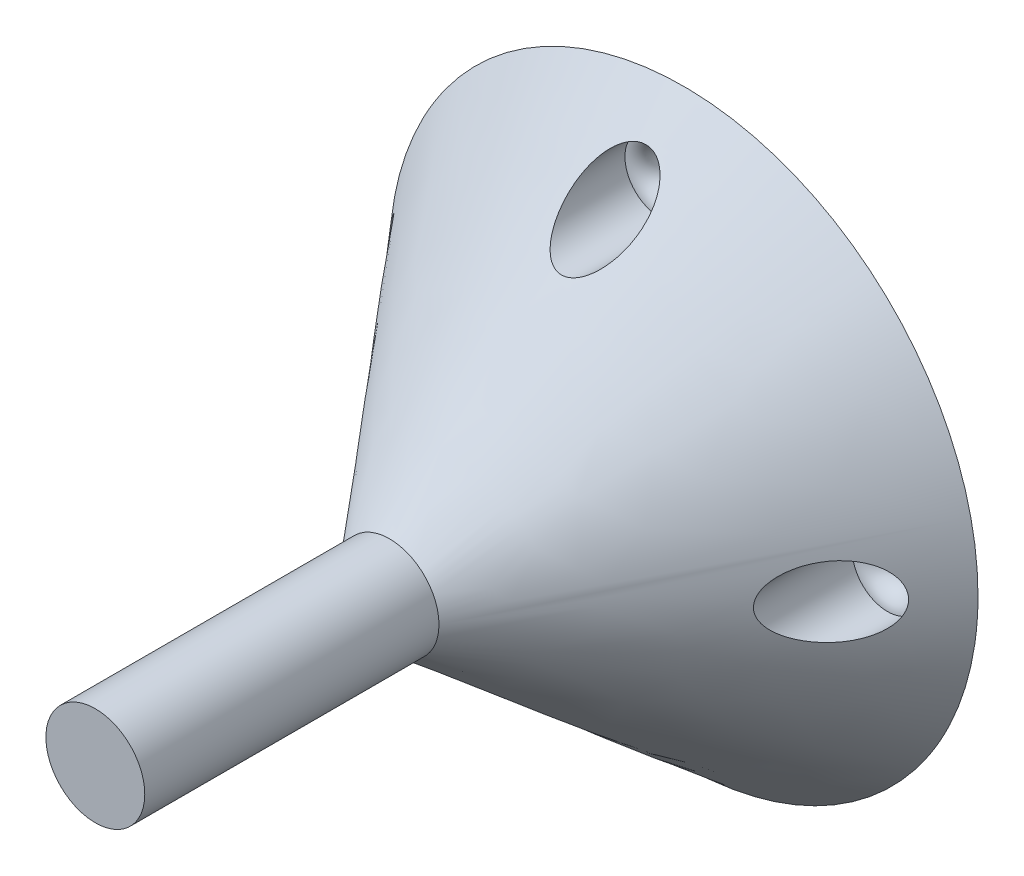
from build123d import *

# Parameters (mm, degrees)
SCHIZZO3_R                   = 4.2
ESTRUSIONE_ESTRUSIONE1_DEPTH = 25
SCHIZZO4_R                   = 1.6000000000000003
SCHIZZO4_R_2                 = 1.6000000000000016
TAGLIO_ESTRUSIONE1_DEPTH     = 25
SCHIZZO5_R                   = 2.9999999999999996
SCHIZZO5_R_2                 = 3.0000000000004285
SCHIZZO5_R_3                 = 3.000000000001174
SCHIZZO5_R_4                 = 3.0000000000008766
TAGLIO_ESTRUSIONE2_DEPTH     = 22.999999999999993
RACCORDO1_R                  = 1.5
RACCORDO2_R                  = 1.5
RACCORDO3_R                  = 1.5
RACCORDO4_R                  = 1.5


with BuildPart() as part:
    # Loft1: read off the stored shape, not the designer's step
    # Loft1: loft between two sections, ruled curve by curve
    loft1_from = [
        Edge.make_bspline([(-24.22237273, 6.186813341, 0), (-36.595999412, -42.25793212, 0), (11.848746049, -54.631558801, 0), (24.22237273, -6.186813341, 0), (36.595999412, 42.25793212, 0), (-11.848746049, 54.631558801, 0), (-24.22237273, 6.186813341, 0)], [0, 0, 0, 0, 0.5, 0.5, 0.5, 1, 1, 1, 1], 3, [1, 0.333333333333333, 0.333333333333333, 1, 0.333333333333333, 0.333333333333333, 1]),
    ]
    loft1_to = [
        Edge.make_bspline([(-3.742227402, 1.906760099, 25), (-7.555747599, -5.577694704, 25), (-0.071292796, -9.391214902, 25), (3.742227402, -1.906760099, 25), (7.555747599, 5.577694704, 25), (0.071292796, 9.391214902, 25), (-3.742227402, 1.906760099, 25)], [0, 0, 0, 0, 0.5, 0.5, 0.5, 1, 1, 1, 1], 3, [1, 0.333333333333333, 0.333333333333333, 1, 0.333333333333333, 0.333333333333333, 1]),
    ]
    loft1 = Solid(Shell([*[Face.make_surface_from_curves(loft1_from[k], loft1_to[k]) for k in range(1)], Face(Wire(loft1_from)), Face(Wire(loft1_to))]))
    add(loft1)

    # Schizzo3 → Estrusione-Estrusione1 (add)
    with BuildSketch(Plane.XY.offset(25)):
        with Locations(Location((0, 0, 0), (0, 0, 153))):
            Circle(SCHIZZO3_R)
    extrude(amount=ESTRUSIONE_ESTRUSIONE1_DEPTH)

    # Schizzo4 → Taglio-Estrusione1 (cut)
    with BuildSketch(Plane.XY.offset(25)):
        with Locations((0, 19.31473002952617)):
            Circle(SCHIZZO4_R)
        with Locations((19.314730029526658, 4.888e-13)):
            Circle(SCHIZZO4_R_2)
        with Locations((9.7759e-13, -19.31473002952617)):
            Circle(SCHIZZO4_R)
        with Locations((-19.314730029525684, -4.9116e-13)):
            Circle(SCHIZZO4_R_2)
    extrude(amount=-TAGLIO_ESTRUSIONE1_DEPTH, mode=Mode.SUBTRACT)

    # Schizzo5 → Taglio-Estrusione2 (cut)
    with BuildSketch(Plane.XY.offset(25)):
        with Locations((0, 19.31473002952617)):
            Circle(SCHIZZO5_R)
        with Locations((19.314730029526718, 5.4659e-13)):
            Circle(SCHIZZO5_R_2)
        with Locations((1.09318e-12, -19.31473002952617)):
            Circle(SCHIZZO5_R_3)
        with Locations((-19.314730029525627, -5.4896e-13)):
            Circle(SCHIZZO5_R_4)
    extrude(amount=-TAGLIO_ESTRUSIONE2_DEPTH, mode=Mode.SUBTRACT)

    # Raccordo1
    # the kernel refuses this fillet: 1.5 mm, written as the material it takes off along each edge
    with BuildSketch(Plane(origin=(-19.314730029525684, -4.9116e-13, 2.000000000000007), x_dir=(1, 0, 0), z_dir=(0, -1, 0))) as raccordo1_piece_1:
        with BuildLine():
            CenterArc((3.1000000000000014, -1.496662954709631), RACCORDO1_R, 93.82255372924298, 86.17744627075702)
            Line((1.6000000000000014, -1.496662954709631), (1.5700000000000003, -1.496662954709631))
            Line((1.5700000000000003, -1.496662954709631), (1.5700000000000003, 0))
            Line((1.5700000000000003, 0), (1.6000000000000014, 0.0299999999999998))
            ThreePointArc((1.6000000000000014, 0.0299999999999998), (2.3000000000004093, 0.0299999999999998), (2.998000000000836, 0.02993325909419253))
            Line((2.998000000000836, 0.02993325909419253), (3.0000000000008207, 0))
        make_face()
    revolve(axis=Axis((-19.314730029525684, -4.9116e-13, 2.000000000000007), (0, 0, 1)), mode=Mode.SUBTRACT)

    # Raccordo2
    # the kernel refuses this fillet: 1.5 mm, written as the material it takes off along each edge
    with BuildSketch(Plane(origin=(0, 19.31473002952617, 2.000000000000007), x_dir=(1, 0, 0), z_dir=(0, -1, 0))) as raccordo2_piece_1:
        with BuildLine():
            CenterArc((3.1000000000000005, -1.4966629547095778), RACCORDO2_R, 93.82255372927438, 86.17744627072562)
            Line((2.9999999999999996, -1.33e-15), (2.9979999999999993, 0.02993325909419031))
            ThreePointArc((2.9979999999999993, 0.02993325909419031), (2.3, 0.0299999999999998), (1.6000000000000003, 0.0299999999999998))
            Line((1.6000000000000003, 0.0299999999999998), (1.5700000000000003, 0))
            Line((1.5700000000000003, 0), (1.5700000000000005, -1.4966629547095778))
            Line((1.5700000000000005, -1.4966629547095778), (1.6000000000000005, -1.4966629547095778))
        make_face()
    revolve(axis=Axis((0, 19.31473002952617, 2.000000000000007), (0, 0, 1)), mode=Mode.SUBTRACT)

    # Raccordo3
    # the kernel refuses this fillet: 1.5 mm, written as the material it takes off along each edge
    with BuildSketch(Plane(origin=(19.314730029526658, 4.888e-13, 2.000000000000007), x_dir=(1, 0, 0), z_dir=(0, -1, 0))) as raccordo3_piece_1:
        with BuildLine():
            CenterArc((3.1000000000000014, -1.4966629547096026), RACCORDO3_R, 93.82255372926026, 86.17744627073972)
            Line((3.0000000000003695, -1.78e-15), (2.9980000000003777, 0.02993325909419031))
            ThreePointArc((2.9980000000003777, 0.02993325909419031), (2.3000000000001855, 0.0299999999999998), (1.6000000000000014, 0.0299999999999998))
            Line((1.6000000000000014, 0.0299999999999998), (1.5700000000000003, 0))
            Line((1.5700000000000003, 0), (1.5700000000000003, -1.4966629547096026))
            Line((1.5700000000000003, -1.4966629547096026), (1.6000000000000014, -1.4966629547096026))
        make_face()
    revolve(axis=Axis((19.314730029526658, 4.888e-13, 2.000000000000007), (0, 0, 1)), mode=Mode.SUBTRACT)

    # Raccordo4
    # the kernel refuses this fillet: 1.5 mm, written as the material it takes off along each edge
    with BuildSketch(Plane(origin=(9.7759e-13, -19.31473002952617, 2.000000000000007), x_dir=(1, 0, 0), z_dir=(0, -1, 0))) as raccordo4_piece_1:
        with BuildLine():
            CenterArc((3.1, -1.4966629547096488), RACCORDO4_R, 93.82255372923383, 86.17744627076615)
            Line((3.0000000000010583, -1.78e-15), (2.9980000000010794, 0.0299332590941912))
            ThreePointArc((2.9980000000010794, 0.0299332590941912), (2.300000000000529, 0.0299999999999998), (1.6000000000000003, 0.0299999999999998))
            Line((1.6000000000000003, 0.0299999999999998), (1.5700000000000003, 0))
            Line((1.5700000000000003, 0), (1.5700000000000003, -1.4966629547096488))
            Line((1.5700000000000003, -1.4966629547096488), (1.6000000000000003, -1.4966629547096488))
        make_face()
    revolve(axis=Axis((9.7759e-13, -19.31473002952617, 2.000000000000007), (0, 0, 1)), mode=Mode.SUBTRACT)


solid = part.part
